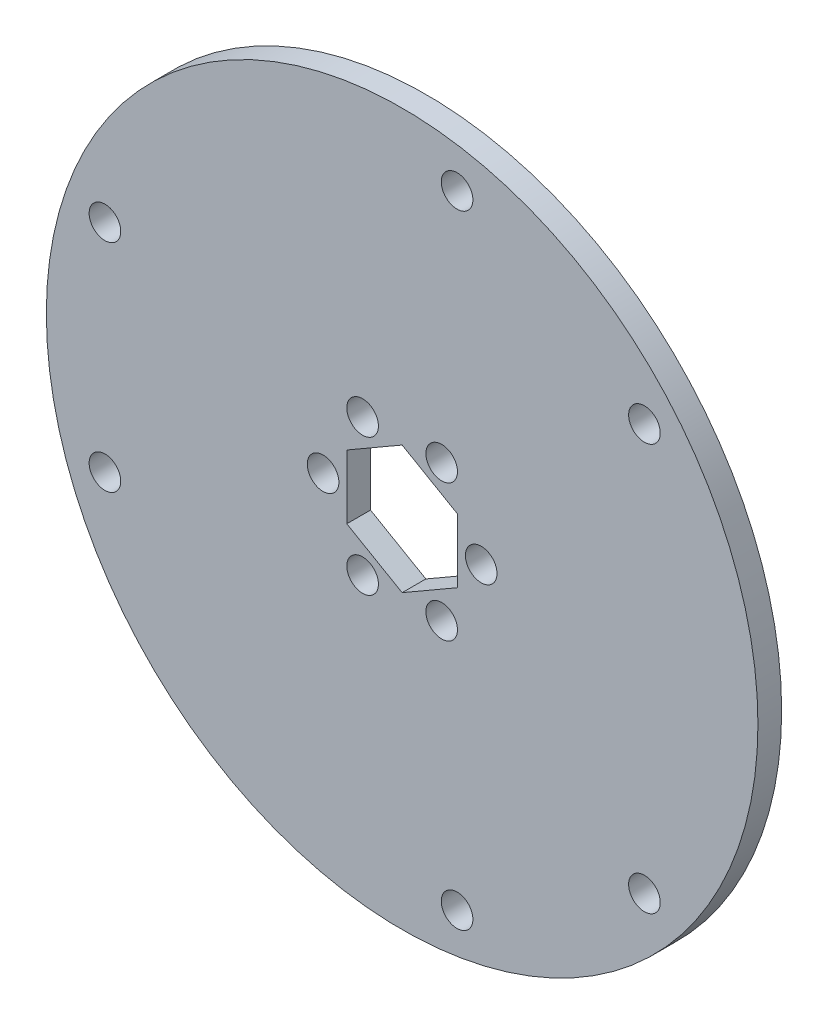
from build123d import *

# Parameters (mm, degrees)
SKETCH1_R           = 45
SKETCH1_R_2         = 2
BOSS_EXTRUDE1_DEPTH = 3


with BuildPart() as part:
    # Sketch1 → Boss-Extrude1 (new body)
    with BuildSketch(Plane.XY):
        Circle(SKETCH1_R)
        with Locations((-37.587704831, 13.680805733)):
            Circle(SKETCH1_R_2, mode=Mode.SUBTRACT)
        with Locations((6.945927107, 39.39231012)):
            Circle(SKETCH1_R_2, mode=Mode.SUBTRACT)
        with Locations((30.641777725, 25.711504387)):
            Circle(SKETCH1_R_2, mode=Mode.SUBTRACT)
        with Locations((-37.587704831, -13.680805733)):
            Circle(SKETCH1_R_2, mode=Mode.SUBTRACT)
        with Locations((6.945927107, -39.39231012)):
            Circle(SKETCH1_R_2, mode=Mode.SUBTRACT)
        with Locations((30.641777725, -25.711504387)):
            Circle(SKETCH1_R_2, mode=Mode.SUBTRACT)
        with Locations((4.999999994, 8.660254041)):
            Circle(SKETCH1_R_2, mode=Mode.SUBTRACT)
        with Locations((-10, -6e-09)):
            Circle(SKETCH1_R_2, mode=Mode.SUBTRACT)
        with Locations((5.000000006, -8.660254035)):
            Circle(SKETCH1_R_2, mode=Mode.SUBTRACT)
        with Locations((-5.000000006, 8.660254035)):
            Circle(SKETCH1_R_2, mode=Mode.SUBTRACT)
        with Locations((-4.999999994, -8.660254041)):
            Circle(SKETCH1_R_2, mode=Mode.SUBTRACT)
        with Locations((10, 6e-09)):
            Circle(SKETCH1_R_2, mode=Mode.SUBTRACT)
        Polygon((0, 8.082903769), (7, 4.041451884), (7, -4.041451884), (0, -8.082903769), (-7, -4.041451884), (-7, 4.041451884), align=None, mode=Mode.SUBTRACT)
    extrude(amount=BOSS_EXTRUDE1_DEPTH)


solid = part.part
